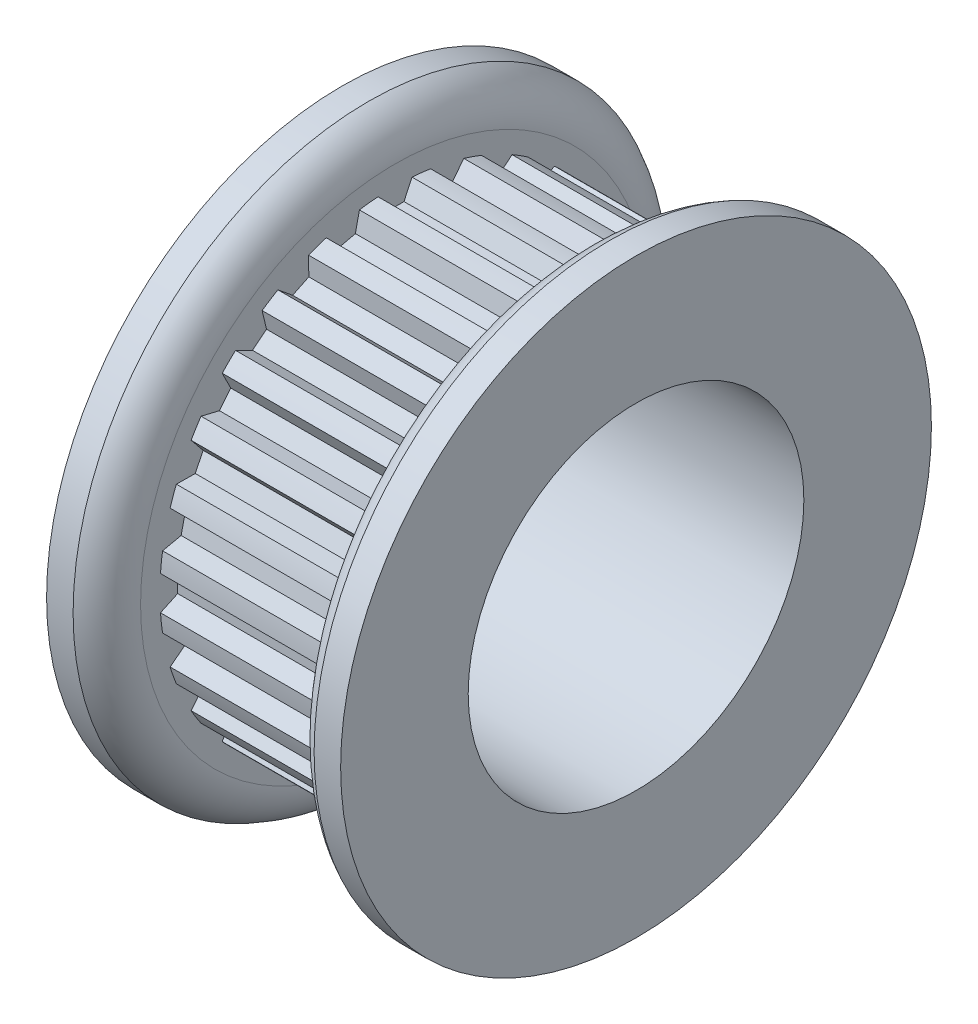
from build123d import *

# Parameters (mm, degrees)
SKETCH4_R          = 9.0551
SKETCH4_R_2        = 8.89635
CUT_EXTRUDE2_DEPTH = 7.112
CUT_EXTRUDE1_DEPTH = 7.112
CIRPATTERN1_COUNT  = 28
SKETCH6_R          = 6.35
CUT_EXTRUDE3_DEPTH = 24.562439751
SPLIT1_START       = -8.7376
SPLIT1_OUTLINE_R   = 8.7376
SPLIT1_OUTLINE_R_2 = 6.35
SPLIT1_DEPTH       = 6.35


# Read off the part's stored shape, not the designer's step: Split1
with BuildPart() as part:
    # Sketch1 → Revolve1 (revolve)
    with BuildSketch(Plane.XY, mode=Mode.PRIVATE) as revolve1_sk:
        with BuildLine():
            Line((-8.7376, 3.175), (8.7376, 3.175))
            Line((8.7376, 3.175), (8.7376, 11.176))
            Line((8.7376, 11.176), (7.7343, 11.176))
            ThreePointArc((7.7343, 11.176), (7.003726949, 10.549537058), (6.731, 9.6266))
            Line((6.731, 9.6266), (6.731, 9.0551))
            Line((6.731, 9.0551), (-0.381, 9.0551))
            Line((-0.381, 9.0551), (-0.381, 9.6266))
            ThreePointArc((-0.381, 9.6266), (-0.653726949, 10.549537058), (-1.3843, 11.176))
            Line((-1.3843, 11.176), (-2.3876, 11.176))
            Line((-2.3876, 11.176), (-2.3876, 8.7376))
            Line((-2.3876, 8.7376), (-8.7376, 8.7376))
            Line((-8.7376, 8.7376), (-8.7376, 3.175))
        make_face()
    revolve(revolve1_sk.sketch.rotate(Axis((-8.7376, 0, 0), (1, 0, 0)), 90), axis=Axis((-8.7376, 0, 0), (1, 0, 0)))

    # Sketch4 → Cut-Extrude2 (cut)
    with BuildSketch(Plane(origin=(-0.381, 0, 0), x_dir=(0, 0, -1), z_dir=(1, 0, 0))):
        Circle(SKETCH4_R)
        Circle(SKETCH4_R_2, mode=Mode.SUBTRACT)
    extrude(amount=CUT_EXTRUDE2_DEPTH, mode=Mode.SUBTRACT)

    # Sketch3 → Cut-Extrude1 (cut)
    with BuildSketch(Plane(origin=(-0.381, 0, 0), x_dir=(0, 0, -1), z_dir=(1, 0, 0))):
        with BuildLine():
            Line((-0.643388094, 8.873054439), (-0.340062676, 8.222570981))
            Line((-0.340062676, 8.222570981), (0.340062676, 8.222570981))
            Line((0.340062676, 8.222570981), (0.643388094, 8.873054439))
            ThreePointArc((0.643388094, 8.873054439), (0, 8.89635), (-0.643388094, 8.873054439))
        make_face()
    cut_extrude1 = extrude(amount=CUT_EXTRUDE1_DEPTH, mode=Mode.SUBTRACT)

    # CirPattern1: Cut-Extrude1 ×28 about axis
    cirpattern1_axis = Axis((0, 0, 0), (1, 0, 0))
    for i in range(1, CIRPATTERN1_COUNT):
        add(cut_extrude1.rotate(cirpattern1_axis, i * 360 / CIRPATTERN1_COUNT), mode=Mode.SUBTRACT)

    # Sketch6 → Cut-Extrude3 (cut, through all)
    with BuildSketch(Plane.ZY.offset(8.7376)):
        Circle(SKETCH6_R)
    extrude(amount=-CUT_EXTRUDE3_DEPTH, mode=Mode.SUBTRACT)

    # Split1 outline → Split1 (cut)
    with BuildSketch(Plane.YZ.offset(SPLIT1_START)):
        Circle(SPLIT1_OUTLINE_R)
        Circle(SPLIT1_OUTLINE_R_2, mode=Mode.SUBTRACT)
    extrude(amount=SPLIT1_DEPTH, mode=Mode.SUBTRACT)


solid = part.part
